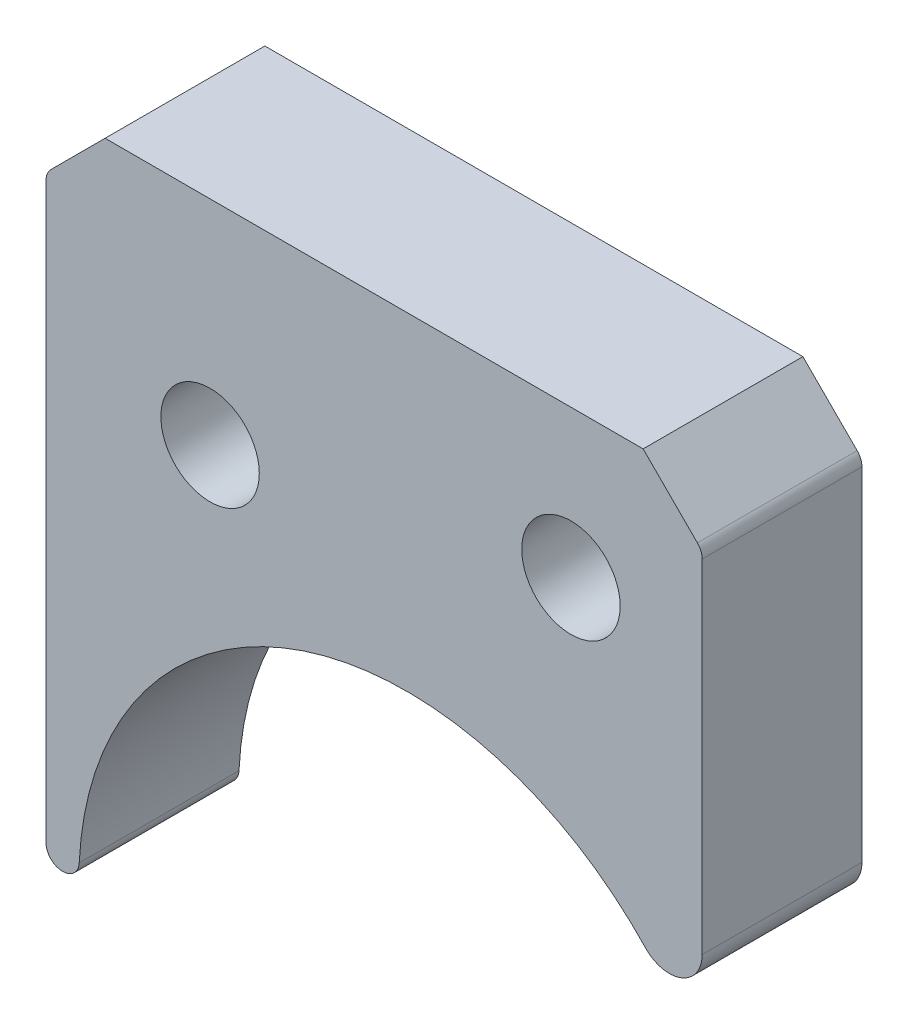
from build123d import *

# Parameters (mm, degrees)
BOSS_EXTRUDE1_DEPTH = 4.87
SKETCH2_R           = 1.5
CUT_EXTRUDE1_DEPTH  = 4.87
CHAMFER1_SIZE       = 1.8
FILLET1_R           = 0.5
FILLET2_R           = 1


with BuildPart() as part:
    # Sketch1 → Boss-Extrude1 (new body)
    with BuildSketch(Plane.XY):
        with BuildLine():
            Line((0, 0), (1, 0))
            ThreePointArc((1, 0), (8.763932023, 9.746794345), (20, 4.358898944))
            Line((20, 4.358898944), (20, 20))
            Line((20, 20), (0, 20))
            Line((0, 20), (0, 0))
        make_face()
    extrude(amount=BOSS_EXTRUDE1_DEPTH)

    # Sketch2 → Cut-Extrude1 (cut)
    with BuildSketch(Plane.XY.offset(4.87)):
        with Locations((5, 13.5)):
            Circle(SKETCH2_R)
        with Locations((16, 15.5)):
            Circle(SKETCH2_R)
    extrude(amount=-CUT_EXTRUDE1_DEPTH, mode=Mode.SUBTRACT)

    # Chamfer1
    chamfer1_edges = [part.edges().sort_by_distance(p)[0] for p in [
        (0, 20, 2.435),
        (20, 20, 2.435),
    ]]
    chamfer(chamfer1_edges, length=CHAMFER1_SIZE)

    # Fillet1
    fillet1_edges = [part.edges().sort_by_distance(p)[0] for p in [
        (0, 0, 2.435),
        (1, 0, 2.435),
        (20, 18.2, 2.435),
        (0, 18.2, 2.435),
    ]]
    fillet(fillet1_edges, radius=FILLET1_R)

    # Fillet2
    fillet2_edges = [part.edges().sort_by_distance(p)[0] for p in [
        (20, 4.358898944, 2.435),
    ]]
    fillet(fillet2_edges, radius=FILLET2_R)


solid = part.part
